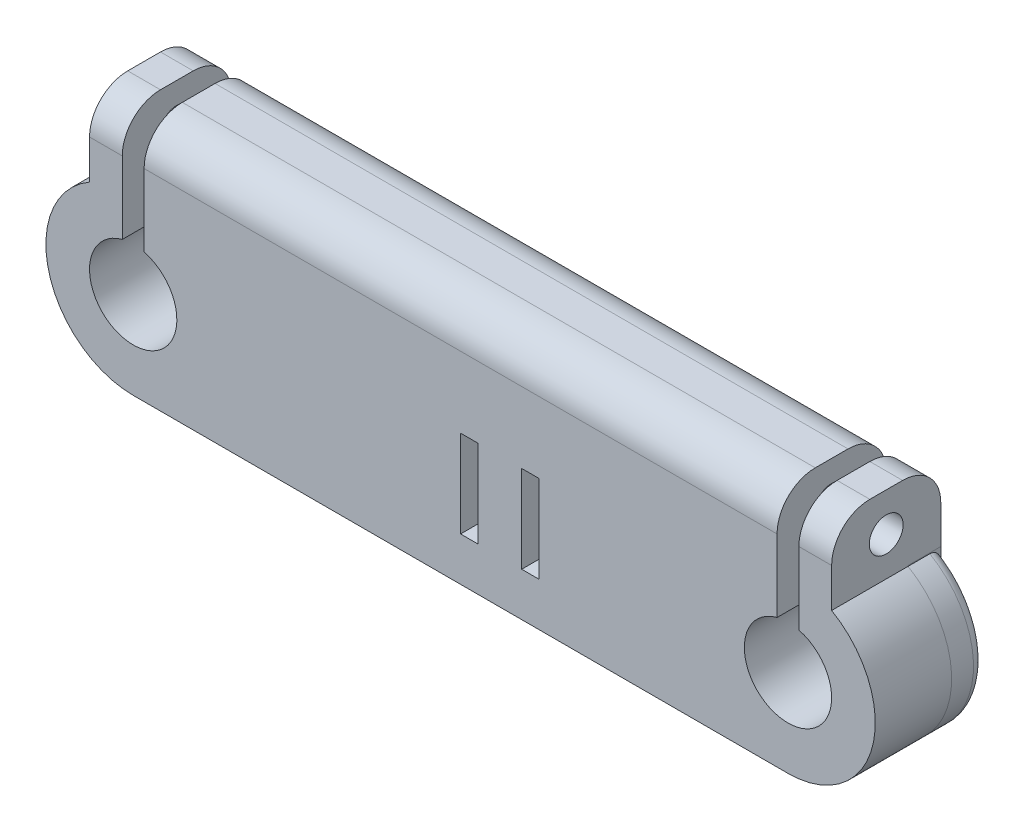
from build123d import *

# Parameters (mm, degrees)
BOSS_EXTRUDE1_DEPTH = 10
SKETCH2_R           = 1.55
CUT_EXTRUDE1_DEPTH  = 10
FILLET1_R           = 3.5
BOSS_EXTRUDE2_DEPTH = 3
SKETCH4_R           = 1.55
CUT_EXTRUDE2_DEPTH  = 9
SPLIT2_START        = 16.573368434
SPLIT2_OUTLINE_W    = 3
SPLIT2_OUTLINE_H    = 3
SPLIT2_OUTLINE_W_2  = 58
SPLIT2_DEPTH        = 8.426631566
SPLIT2_START_2      = -18.925043944
SPLIT2_2_DEPTH      = 3
SPLIT2_START_3      = -13.925043944
SPLIT2_3_DEPTH      = 58
SPLIT2_START_4      = 46.074956056
SPLIT2_4_DEPTH      = 3
SKETCH5_R           = 1.55
BOSS_EXTRUDE3_DEPTH = 3
SKETCH6_W           = 1.6
SKETCH6_H           = 8
CUT_EXTRUDE3_DEPTH  = 7
SKETCH7_W           = 7.2
SKETCH7_H           = 8
CUT_EXTRUDE4_DEPTH  = 1.6
FILLET2_R           = 1


with BuildPart() as part:
    # Sketch1 → Boss-Extrude1 (new body)
    with BuildSketch(Plane.XY):
        with BuildLine():
            Line((-14.925043944, 1.573368434), (45.074956056, 1.573368434))
            ThreePointArc((45.074956056, 1.573368434), (52.802362666, 7.502816073), (49.074956056, 16.501571665))
            Line((49.074956056, 16.501571665), (49.074956056, 23.573368434))
            Line((49.074956056, 23.573368434), (46.074956056, 23.573368434))
            Line((46.074956056, 23.573368434), (46.074956056, 13.44635178))
            ThreePointArc((46.074956056, 13.44635178), (45.074956056, 5.573368434), (44.074956056, 13.44635178))
            Line((44.074956056, 13.44635178), (44.074956056, 23.573368434))
            Line((44.074956056, 23.573368434), (-13.925043944, 23.573368434))
            Line((-13.925043944, 23.573368434), (-13.925043944, 13.44635178))
            ThreePointArc((-13.925043944, 13.44635178), (-14.925043944, 5.573368434), (-15.925043944, 13.44635178))
            Line((-15.925043944, 13.44635178), (-15.925043944, 23.573368434))
            Line((-15.925043944, 23.573368434), (-18.925043944, 23.573368434))
            Line((-18.925043944, 23.573368434), (-18.925043944, 16.501571665))
            ThreePointArc((-18.925043944, 16.501571665), (-22.652450555, 7.502816073), (-14.925043944, 1.573368434))
        make_face()
    extrude(amount=BOSS_EXTRUDE1_DEPTH)

    # Sketch2 → Cut-Extrude1 (cut)
    with BuildSketch(Plane.ZY.offset(18.925043944)):
        with Locations((5, 20.037470049)):
            Circle(SKETCH2_R)
    cut_extrude1 = extrude(amount=-CUT_EXTRUDE1_DEPTH, mode=Mode.SUBTRACT)

    # Fillet1
    fillet1_edges = [part.edges().sort_by_distance(p)[0] for p in [
        (-17.425043944, 23.573368434, 0),
        (15.074956056, 23.573368434, 0),
        (47.574956056, 23.573368434, 0),
        (47.574956056, 23.573368434, 10),
        (15.074956056, 23.573368434, 10),
        (-17.425043944, 23.573368434, 10),
    ]]
    fillet(fillet1_edges, radius=FILLET1_R)

    # Mirror1: Cut-Extrude1 across plane
    add(cut_extrude1.mirror(Plane.ZY.offset(-15.074956056)), mode=Mode.SUBTRACT)

    # Sketch4 → Cut-Extrude2 (cut)
    with BuildSketch(Plane(origin=(0, 0, 0), x_dir=(-1, 0, 0), z_dir=(0, 0, -1))):
        with Locations((-35.074956056, 9.573368434)):
            Circle(SKETCH4_R)
        with Locations(Location((4.925043944, 9.573368434, 0), (0, 0, 180))):
            Circle(SKETCH4_R)
    extrude(amount=-CUT_EXTRUDE2_DEPTH, mode=Mode.SUBTRACT)


with BuildPart() as body_2:
    # Sketch3 → Boss-Extrude2 (new body)
    with BuildSketch(Plane(origin=(0, 0, 0), x_dir=(-1, 0, 0), z_dir=(0, 0, -1))):
        with BuildLine():
            Line((-45.074956056, 17.573368434), (14.925043944, 17.573368434))
            ThreePointArc((14.925043944, 17.573368434), (22.925043944, 9.573368434), (14.925043944, 1.573368434))
            Line((14.925043944, 1.573368434), (-45.074956056, 1.573368434))
            ThreePointArc((-45.074956056, 1.573368434), (-53.074956056, 9.573368434), (-45.074956056, 17.573368434))
        make_face()
    extrude(amount=BOSS_EXTRUDE2_DEPTH)


with BuildPart() as body_3:
    # Split1: the piece on the far side of the plane
    add(part.part)
    split(bisect_by=Plane(origin=(0, 0, 3), x_dir=(-1, 0, 0), z_dir=(0, 0, -1)), keep=Keep.BOTTOM)


with BuildPart() as part_1:
    add(part.part)

    # Split1
    split(bisect_by=Plane(origin=(0, 0, 3), x_dir=(-1, 0, 0), z_dir=(0, 0, -1)), keep=Keep.TOP)

    # Split2: read off the stored shape, not the designer's step
    # Split2 outline → Split2 (cut)
    with BuildSketch(Plane(origin=(0, 0, 0), x_dir=(1, 0, 0), z_dir=(0, 1, 0)).offset(SPLIT2_START)):
        with Locations((47.574956056, -1.5)):
            Rectangle(SPLIT2_OUTLINE_W, SPLIT2_OUTLINE_H)
        with Locations((15.074956056, -1.5)):
            Rectangle(SPLIT2_OUTLINE_W_2, SPLIT2_OUTLINE_H)
        with Locations((-17.425043944, -1.5)):
            Rectangle(SPLIT2_OUTLINE_W, SPLIT2_OUTLINE_H)
    extrude(amount=SPLIT2_DEPTH, mode=Mode.SUBTRACT)


with BuildPart() as body_4:
    # Split2 2 outline → Split2 2 (new body)
    with BuildSketch(Plane.YZ.offset(SPLIT2_START_2)):
        with BuildLine():
            Line((16.573368434, 3), (16.573368434, 0))
            Line((16.573368434, 0), (20.073368434, 0))
            ThreePointArc((20.073368434, 0), (22.364656282, 0.854248689), (23.537470049, 3))
            Line((23.537470049, 3), (16.573368434, 3))
        make_face()
    extrude(amount=SPLIT2_2_DEPTH)


with BuildPart() as body_5:
    # Split2 3 outline → Split2 3 (new body)
    with BuildSketch(Plane.YZ.offset(SPLIT2_START_3)):
        with BuildLine():
            Line((16.573368434, 3), (16.573368434, 0))
            Line((16.573368434, 0), (20.073368434, 0))
            ThreePointArc((20.073368434, 0), (22.364656282, 0.854248689), (23.537470049, 3))
            Line((23.537470049, 3), (16.573368434, 3))
        make_face()
    extrude(amount=SPLIT2_3_DEPTH)


with BuildPart() as body_6:
    # Split2 4 outline → Split2 4 (new body)
    with BuildSketch(Plane.YZ.offset(SPLIT2_START_4)):
        with BuildLine():
            Line((16.573368434, 3), (16.573368434, 0))
            Line((16.573368434, 0), (20.073368434, 0))
            ThreePointArc((20.073368434, 0), (22.364656282, 0.854248689), (23.537470049, 3))
            Line((23.537470049, 3), (16.573368434, 3))
        make_face()
    extrude(amount=SPLIT2_4_DEPTH)

    # Combine1: union body 5, body 4, body 3
    add(body_5.part)
    add(body_4.part)
    add(body_3.part)

    # Sketch6 → Cut-Extrude3 (cut)
    with BuildSketch(Plane.XY.offset(10)):
        with Locations((15.874956056, 9.573368434)):
            Rectangle(SKETCH6_W, SKETCH6_H)
        with Locations((21.474956056, 9.573368434)):
            Rectangle(SKETCH6_W, SKETCH6_H)
    extrude(amount=-CUT_EXTRUDE3_DEPTH, mode=Mode.SUBTRACT)


with BuildPart() as body_4_2:
    # Sketch5 → Boss-Extrude3 (new body)
    with BuildSketch(Plane(origin=(0, 0, 0), x_dir=(-1, 0, 0), z_dir=(0, 0, -1))):
        with BuildLine():
            Line((-46.074956056, 16.573368434), (-44.074956056, 16.573368434))
            Line((-44.074956056, 16.573368434), (13.925043944, 16.573368434))
            Line((13.925043944, 16.573368434), (15.925043944, 16.573368434))
            Line((15.925043944, 16.573368434), (18.925043944, 16.573368434))
            Line((18.925043944, 16.573368434), (18.925043944, 16.501571665))
            ThreePointArc((18.925043944, 16.501571665), (22.652450555, 7.502816073), (14.925043944, 1.573368434))
            Line((14.925043944, 1.573368434), (-45.074956056, 1.573368434))
            ThreePointArc((-45.074956056, 1.573368434), (-52.802362666, 7.502816073), (-49.074956056, 16.501571665))
            Line((-49.074956056, 16.501571665), (-49.074956056, 16.573368434))
            Line((-49.074956056, 16.573368434), (-46.074956056, 16.573368434))
        make_face()
        with Locations((4.925043944, 9.573368434)):
            Circle(SKETCH5_R, mode=Mode.SUBTRACT)
        with Locations((-35.074956056, 9.573368434)):
            Circle(SKETCH5_R, mode=Mode.SUBTRACT)
    extrude(amount=-BOSS_EXTRUDE3_DEPTH)

    # Sketch7 → Cut-Extrude4 (cut)
    with BuildSketch(Plane.XY.offset(3)):
        with Locations((18.674956056, 9.573368434)):
            Rectangle(SKETCH7_W, SKETCH7_H)
    extrude(amount=-CUT_EXTRUDE4_DEPTH, mode=Mode.SUBTRACT)

    # Fillet2
    fillet2_edges = [body_4_2.edges().sort_by_distance(p)[0] for p in [
        (-22.652450555, 7.502816073, 0),
        (15.074956056, 1.573368434, 0),
        (52.802362666, 7.502816073, 0),
    ]]
    fillet(fillet2_edges, radius=FILLET2_R)


solid = Compound([body_6.part, body_4_2.part])
